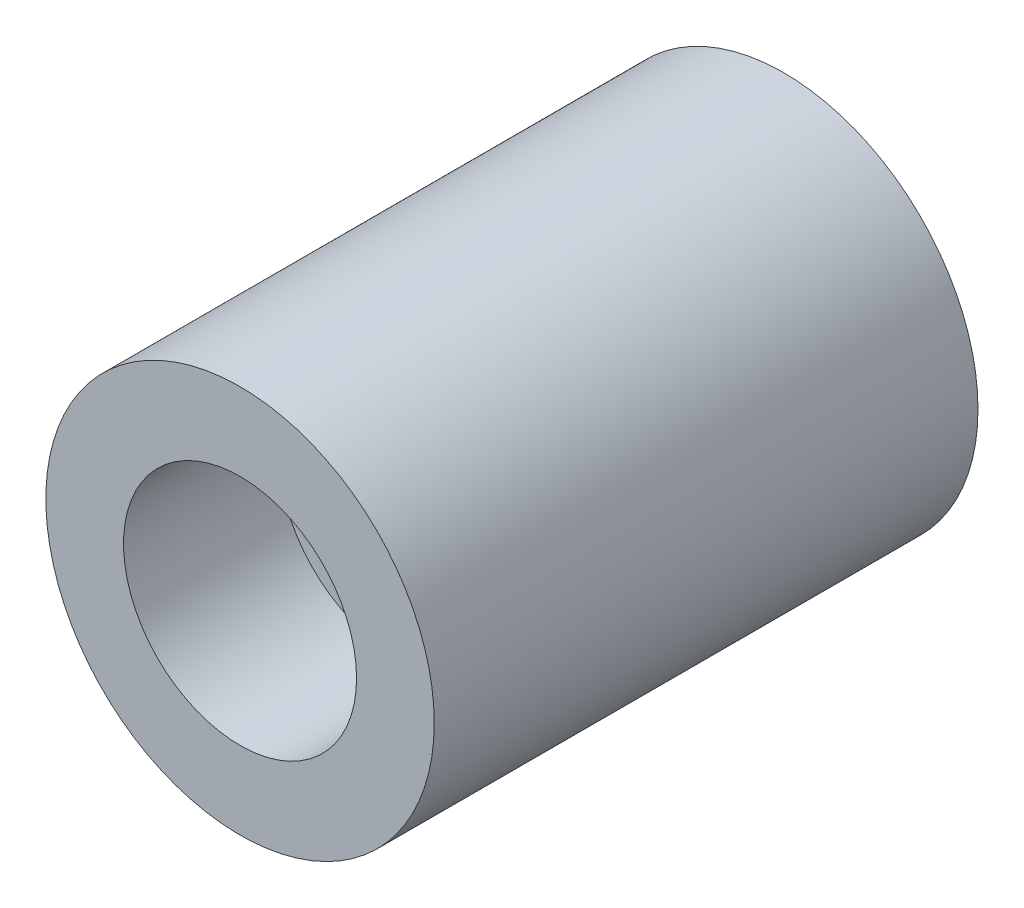
from build123d import *

# Parameters (mm, degrees)
ESQUISSE1_R        = 10
BOSS_EXTRU_1_DEPTH = 20
ESQUISSE1_3_R      = 30
ESQUISSE1_3_R_2    = 10
BOSS_EXTRU_2_DEPTH = 100
ESQUISSE1_4_R      = 50
ESQUISSE1_4_R_2    = 30
BOSS_EXTRU_3_DEPTH = 140


with BuildPart() as part:
    # Esquisse1 → Boss.-Extru.1 (new body)
    with BuildSketch(Plane.XY):
        Circle(ESQUISSE1_R)
    extrude(amount=BOSS_EXTRU_1_DEPTH)

    # Esquisse1<3> → Boss.-Extru.2 (add)
    with BuildSketch(Plane.XY):
        Circle(ESQUISSE1_3_R)
        Circle(ESQUISSE1_3_R_2, mode=Mode.SUBTRACT)
    extrude(amount=BOSS_EXTRU_2_DEPTH)

    # Esquisse1<4> → Boss.-Extru.3 (add)
    with BuildSketch(Plane.XY):
        Circle(ESQUISSE1_4_R)
        Circle(ESQUISSE1_4_R_2, mode=Mode.SUBTRACT)
    extrude(amount=BOSS_EXTRU_3_DEPTH)


solid = part.part
